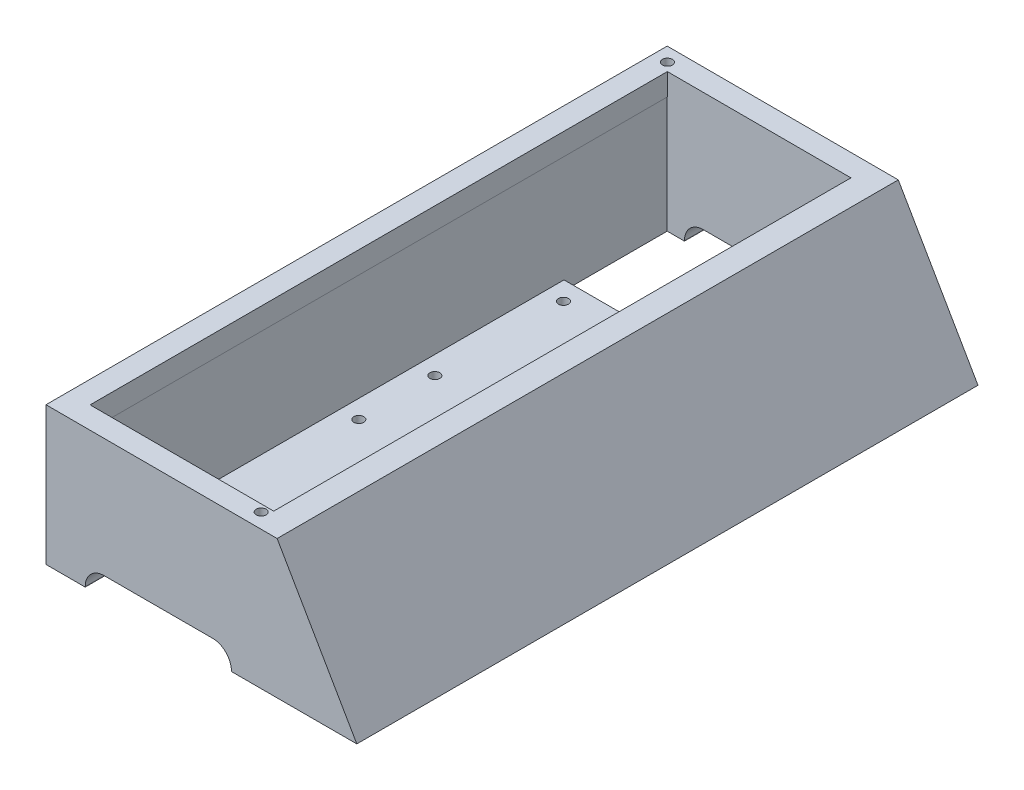
from build123d import *

# Parameters (mm, degrees)
BOSS_EXTRUDE1_DEPTH = 198
SHELL1_T            = -7
SKETCH2_W           = 184
SKETCH2_H           = 91.833810452
CUT_EXTRUDE1_DEPTH  = 10
SKETCH3_W           = 51.015734787
SKETCH3_H           = 184
CUT_EXTRUDE3_DEPTH  = 10
SKETCH4_W           = 43.227096231
SKETCH4_H           = 118.22
SKETCH4_W_2         = 10
SKETCH4_H_2         = 10
BOSS_EXTRUDE2_DEPTH = 3
SKETCH6_R           = 1.585
CUT_EXTRUDE5_DEPTH  = 10
SKETCH10_R          = 1.585
CUT_EXTRUDE8_DEPTH  = 5
SKETCH9_W           = 46.592666587
SKETCH9_H           = 6.179476357
CUT_EXTRUDE7_DEPTH  = 10
FILLET1_R           = 6
FILLET2_R           = 6
SKETCH11_R          = 1.585
CUT_EXTRUDE9_DEPTH  = 5
SKETCH12_R          = 1.585
CUT_EXTRUDE10_DEPTH = 5


with BuildPart() as part:
    # Sketch1 → Boss-Extrude1 (new body)
    with BuildSketch(Plane.XY):
        Polygon((0, 0), (99.07, 0), (73.665, 44.002750766), (0, 44.1), align=None)
    extrude(amount=BOSS_EXTRUDE1_DEPTH)

    # Shell1
    shell1_openings = [part.faces().sort_by_distance(p)[0] for p in [
        (49.535, 0, 99),
    ]]
    offset(amount=SHELL1_T, openings=shell1_openings, kind=Kind.INTERSECTION)

    # Sketch2 → Cut-Extrude1 (cut)
    with BuildSketch(Plane(origin=(68.240322174, 39.398568376, 0), x_dir=(0, 0, 1), z_dir=(-0.866025403784436, -0.5000000000000048, 0))):
        with Locations((99, 0.42335711)):
            Rectangle(SKETCH2_W, SKETCH2_H)
    extrude(amount=CUT_EXTRUDE1_DEPTH, mode=Mode.SUBTRACT)

    # Sketch3 → Cut-Extrude3 (cut)
    with BuildSketch(Plane(origin=(0.058218743, 44.099923142, 0), x_dir=(0.9999991285962467, -0.001320154061894519, 0), z_dir=(0.001320154061894519, 0.9999991285962467, 0))):
        with Locations((32.507861294, -99)):
            Rectangle(SKETCH3_W, SKETCH3_H)
    extrude(amount=-CUT_EXTRUDE3_DEPTH, mode=Mode.SUBTRACT)

    # Sketch4 → Boss-Extrude2 (add)
    with BuildSketch(Plane.XZ):
        with Locations((28.613548116, 99)):
            Rectangle(SKETCH4_W, SKETCH4_H)
        with Locations((85.987096231, 86)):
            Rectangle(SKETCH4_W_2, SKETCH4_H_2)
    boss_extrude2 = extrude(amount=-BOSS_EXTRUDE2_DEPTH)

    # Sketch6 → Cut-Extrude5 (cut)
    with BuildSketch(Plane(origin=(0, 3, 0), x_dir=(1, 0, 0), z_dir=(0, 1, 0))):
        with Locations((12.830469551, -45.887182752)):
            Circle(SKETCH6_R)
        with Locations((12.830469551, -86.887182752)):
            Circle(SKETCH6_R)
        with Locations((12.830469551, -111.112817248)):
            Circle(SKETCH6_R)
        with Locations((12.830469551, -152.112817248)):
            Circle(SKETCH6_R)
    extrude(amount=-CUT_EXTRUDE5_DEPTH, mode=Mode.SUBTRACT)

    # Sketch10 → Cut-Extrude8 (cut)
    with BuildSketch(Plane.XZ):
        with Locations((84.092666587, 85.739056505)):
            Circle(SKETCH10_R)
    cut_extrude8 = extrude(amount=-CUT_EXTRUDE8_DEPTH, mode=Mode.SUBTRACT)

    # Sketch9 → Cut-Extrude7 (cut)
    with BuildSketch(Plane.XY.offset(198)):
        with Locations((35.796333293, 3.089738179)):
            Rectangle(SKETCH9_W, SKETCH9_H)
    cut_extrude7 = extrude(amount=-CUT_EXTRUDE7_DEPTH, mode=Mode.SUBTRACT)

    # Mirror1: Cut-Extrude7 across plane
    add(cut_extrude7.mirror(Plane(origin=(0, 0, 99), x_dir=(1, 0, 0), z_dir=(0, 0, -1))), mode=Mode.SUBTRACT)

    # Fillet1
    fillet1_edges = [part.edges().sort_by_distance(p)[0] for p in [
        (12.5, 6.179476357, 3.5),
        (59.092666587, 6.179476357, 3.5),
    ]]
    fillet(fillet1_edges, radius=FILLET1_R)

    # Fillet2
    fillet2_edges = [part.edges().sort_by_distance(p)[0] for p in [
        (59.092666587, 6.179476357, 194.5),
        (12.5, 6.179476357, 194.5),
    ]]
    fillet(fillet2_edges, radius=FILLET2_R)

    # Mirror2: Boss-Extrude2, Cut-Extrude8 across plane
    add(boss_extrude2.mirror(Plane(origin=(0, 0, 99), x_dir=(1, 0, 0), z_dir=(0, 0, -1))))
    add(cut_extrude8.mirror(Plane(origin=(0, 0, 99), x_dir=(1, 0, 0), z_dir=(0, 0, -1))), mode=Mode.SUBTRACT)

    # Sketch11 → Cut-Extrude9 (cut)
    with BuildSketch(Plane.XZ):
        with Locations((12.830469551, 152.112817248)):
            Circle(SKETCH11_R)
        with Locations((12.830469551, 111.112817248)):
            Circle(SKETCH11_R)
        with Locations((12.830469551, 86.887182752)):
            Circle(SKETCH11_R)
        with Locations((12.830469551, 45.887182752)):
            Circle(SKETCH11_R)
    extrude(amount=-CUT_EXTRUDE9_DEPTH, mode=Mode.SUBTRACT)

    # Sketch12 → Cut-Extrude10 (cut)
    with BuildSketch(Plane(origin=(0.058218743, 44.099923142, 0), x_dir=(0.9999991285962467, -0.001320154061894519, 0), z_dir=(0.001320154061894519, 0.9999991285962467, 0))):
        with Locations((63.768297777, -193.245706001)):
            Circle(SKETCH12_R)
        with Locations((4.416986766, -4.402159503)):
            Circle(SKETCH12_R)
    extrude(amount=-CUT_EXTRUDE10_DEPTH, mode=Mode.SUBTRACT)


solid = part.part
